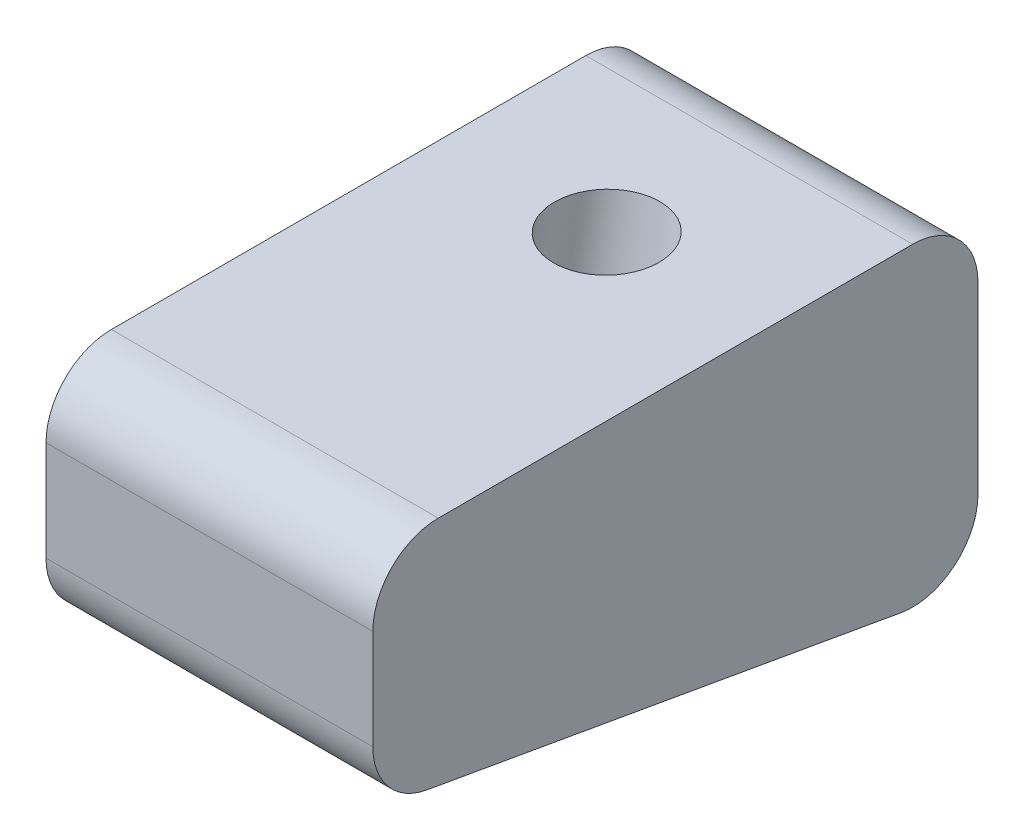
from build123d import *

# Parameters (mm, degrees)
BOSS_EXTRUDE1_DEPTH = 25
SKETCH2_R           = 4
CUT_EXTRUDE1_DEPTH  = 25
FILLET1_R           = 5


with BuildPart() as part:
    # Sketch1 → Boss-Extrude1 (new body)
    with BuildSketch(Plane(origin=(0, 0, 0), x_dir=(0, 0, -1), z_dir=(1, 0, 0))):
        Polygon((0, 0), (-46.285964392, 0), (-46.285964392, -16.83853565), (0, -25), align=None)
    extrude(amount=BOSS_EXTRUDE1_DEPTH)

    # Sketch2 → Cut-Extrude1 (cut)
    with BuildSketch(Plane(origin=(0, -24.24615776, 4.275251792), x_dir=(1, 0, 0), z_dir=(0, -0.9848077530122086, 0.17364817766692736))):
        with Locations((12.5, 15.658795558)):
            Circle(SKETCH2_R)
    extrude(amount=-CUT_EXTRUDE1_DEPTH, mode=Mode.SUBTRACT)

    # Fillet1
    fillet1_edges = [part.edges().sort_by_distance(p)[0] for p in [
        (12.5, -16.83853565, 46.285964392),
        (12.5, -25, 0),
        (12.5, 0, 0),
        (12.5, 0, 46.285964392),
    ]]
    fillet(fillet1_edges, radius=FILLET1_R)


solid = part.part
